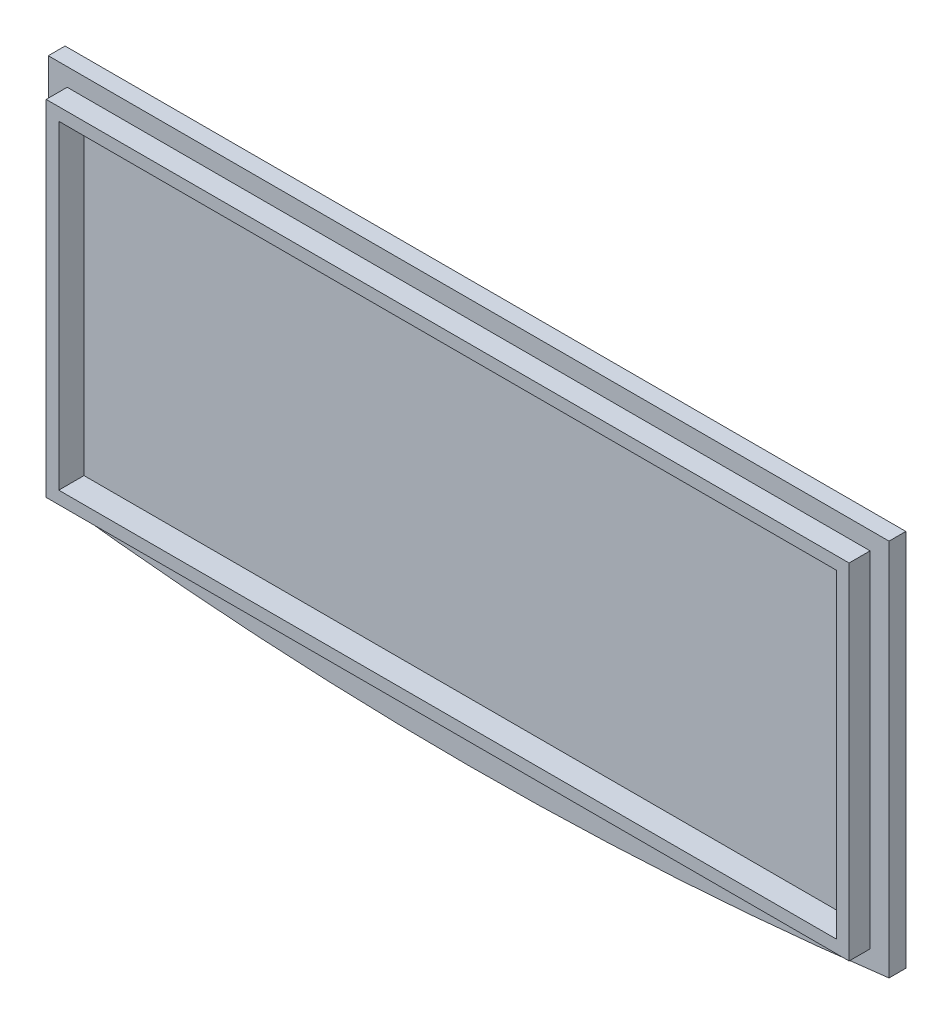
from build123d import *

# Parameters (mm, degrees)
EXTRUDE_1_DEPTH = 1.6
SKETCH_9_W      = 76.4
SKETCH_9_H      = 32.8
EXTRUDE_2_DEPTH = 2
SHELL_2_T       = -1.2


with BuildPart() as part:
    # 草图1 → 凸台-拉伸1 (new body)
    with BuildSketch(Plane.XY):
        with BuildLine():
            ThreePointArc((-90.420566467, -29.667328482), (-50.420566467, -32.163413079), (-10.420566467, -29.667328482))
            Line((-10.420566467, -29.667328482), (-10.420566467, 6.332671518))
            Line((-10.420566467, 6.332671518), (-90.420566467, 6.332671518))
            Line((-90.420566467, 6.332671518), (-90.420566467, -29.667328482))
        make_face()
    extrude(amount=EXTRUDE_1_DEPTH)

    # 草图9 → 凸台-拉伸2 (add)
    with BuildSketch(Plane.XY.offset(1.6)):
        with Locations((-50.420566467, -11.767328482)):
            Rectangle(SKETCH_9_W, SKETCH_9_H)
    extrude(amount=EXTRUDE_2_DEPTH)

    # 抽壳2
    shell_2_openings = [part.faces().sort_by_distance(p)[0] for p in [
        (-50.420566467, -11.767328482, 3.6),
    ]]
    offset(amount=SHELL_2_T, openings=shell_2_openings, kind=Kind.INTERSECTION)


solid = part.part
